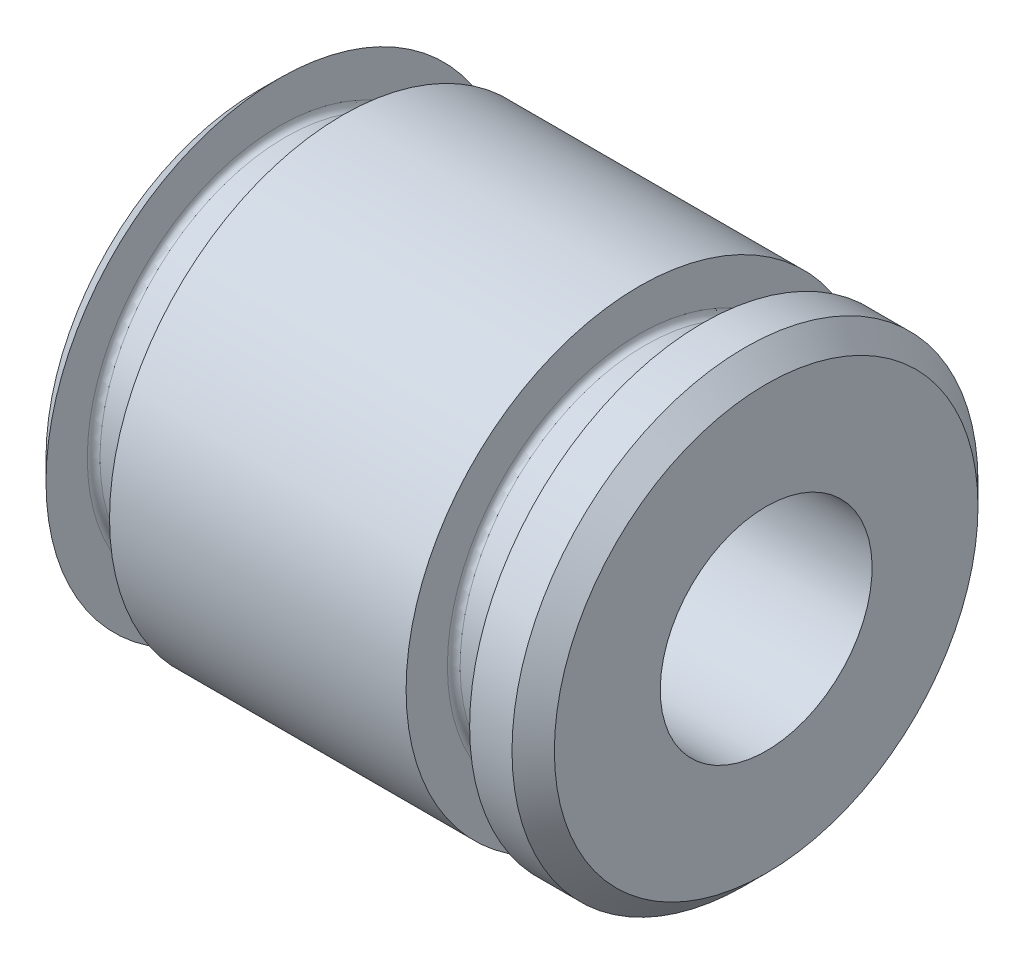
from build123d import *

# Parameters (mm, degrees)
SCHIZZO2_R               = 5
TAGLIO_ESTRUSIONE1_DEPTH = 21
SMUSSO1_SIZE             = 1
RACCORDO1_R              = 0.3


with BuildPart() as part:
    # Schizzo1 → Rivoluzione1 (revolve)
    with BuildSketch(Plane.XY):
        Polygon((0, 0), (0, 11), (1, 11), (1, 8.75), (4, 8.75), (4, 11), (18, 11), (18, 8.75), (21, 8.75), (21, 11), (24, 11), (24, 0), align=None)
    revolve(axis=Axis((24, 0, 0), (-1, 0, 0)))

    # Schizzo2 → Taglio-Estrusione1 (cut)
    with BuildSketch(Plane(origin=(24, 0, 0), x_dir=(0, 0, -1), z_dir=(1, 0, 0))):
        with Locations(Location((0, 0, 0), (0, 0, 90))):
            Circle(SCHIZZO2_R)
    extrude(amount=-TAGLIO_ESTRUSIONE1_DEPTH, mode=Mode.SUBTRACT)

    # Smusso1
    smusso1_edges = [part.edges().sort_by_distance(p)[0] for p in [
        (0, -11, 0),
        (24, -11, 0),
    ]]
    chamfer(smusso1_edges, length=SMUSSO1_SIZE - 0.0001)  # a hair under: the kernel refuses the full size

    # Raccordo1
    raccordo1_edges = [part.edges().sort_by_distance(p)[0] for p in [
        (21, -8.75, 0),
        (18, -8.75, 0),
        (4, -8.75, 0),
        (1, -8.75, 0),
    ]]
    fillet(raccordo1_edges, radius=RACCORDO1_R)


solid = part.part
